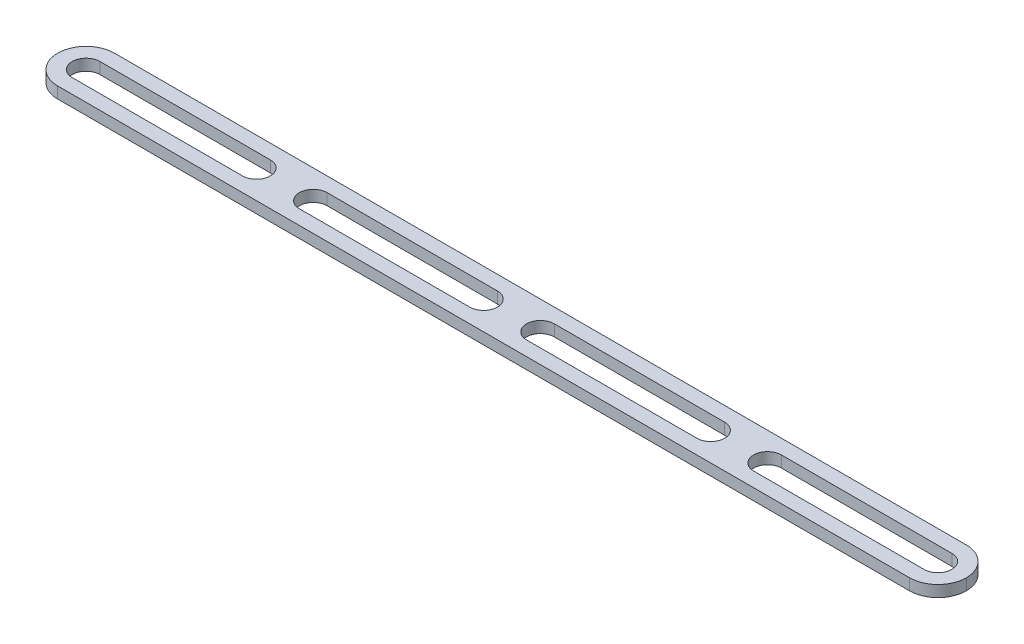
from build123d import *

# Parameters (mm, degrees)
SKETCH_1_W          = 160
SKETCH_1_H          = 10
EXTRUDE_1_DEPTH     = 2
FILLET_1_R          = 5
CUT_EXTRUDE_1_DEPTH = 10


with BuildPart() as part:
    # 스케치1 → 보스-돌출1 (new body)
    with BuildSketch(Plane(origin=(0, 0, 0), x_dir=(1, 0, 0), z_dir=(0, 1, 0))):
        with Locations((80, 5)):
            Rectangle(SKETCH_1_W, SKETCH_1_H)
    extrude(amount=EXTRUDE_1_DEPTH)

    # 필렛1
    fillet_1_edges = [part.edges().sort_by_distance(p)[0] for p in [
        (0, 1, 0),
        (0, 1, -10),
        (160, 1, -10),
        (160, 1, 0),
    ]]
    fillet(fillet_1_edges, radius=FILLET_1_R - 0.0001)  # a hair under: the kernel refuses the full size

    # 스케치2 → 컷-돌출1 (cut)
    with BuildSketch(Plane(origin=(0, 2, 0), x_dir=(1, 0, 0), z_dir=(0, 1, 0))):
        with BuildLine():
            Line((5, 7.45), (35, 7.45))
            ThreePointArc((35, 7.45), (37.45, 5), (35, 2.55))
            Line((35, 2.55), (5, 2.55))
            ThreePointArc((5, 2.55), (2.55, 5), (5, 7.45))
        make_face()
        with BuildLine():
            Line((45, 7.45), (75, 7.45))
            ThreePointArc((75, 7.45), (77.45, 5), (75, 2.55))
            Line((75, 2.55), (45, 2.55))
            ThreePointArc((45, 2.55), (42.55, 5), (45, 7.45))
        make_face()
        with BuildLine():
            Line((85, 7.45), (115, 7.45))
            ThreePointArc((115, 7.45), (117.45, 5), (115, 2.55))
            Line((115, 2.55), (85, 2.55))
            ThreePointArc((85, 2.55), (82.55, 5), (85, 7.45))
        make_face()
        with BuildLine():
            Line((125, 7.45), (155, 7.45))
            ThreePointArc((155, 7.45), (157.45, 5), (155, 2.55))
            Line((155, 2.55), (125, 2.55))
            ThreePointArc((125, 2.55), (122.55, 5), (125, 7.45))
        make_face()
    extrude(amount=-CUT_EXTRUDE_1_DEPTH, mode=Mode.SUBTRACT)


solid = part.part
